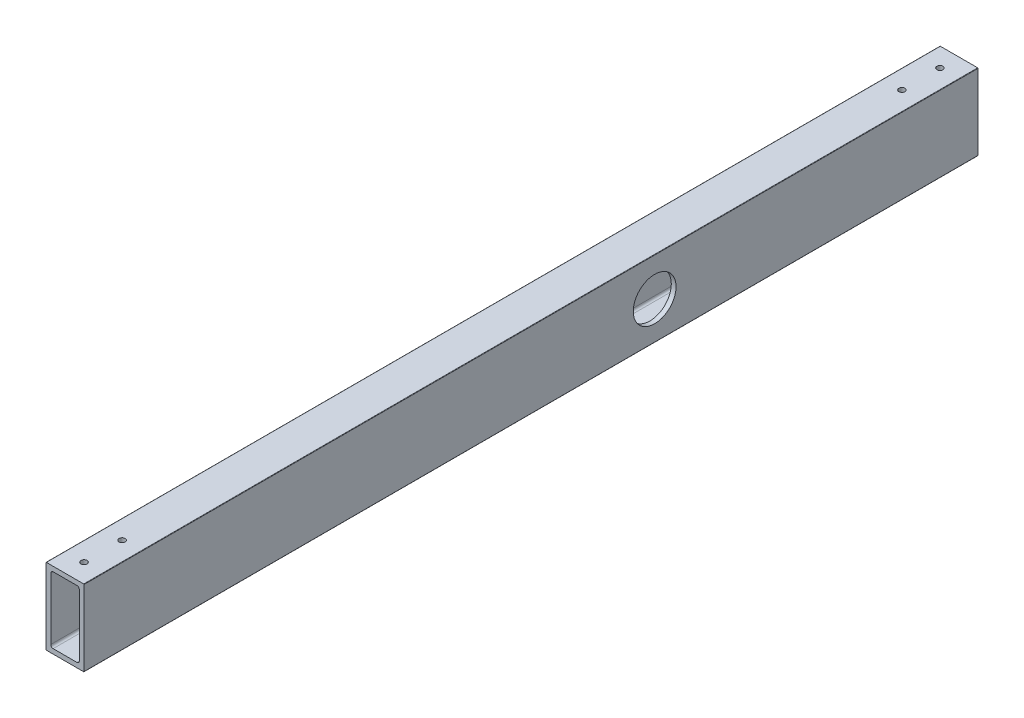
from build123d import *

# Parameters (mm, degrees)
BOSS_EXTRUDE1_DEPTH = 596.9
SKETCH2_R           = 2.032
CUT_EXTRUDE1_DEPTH  = 600.596039013
SKETCH5_R           = 14.2875
CUT_EXTRUDE2_DEPTH  = 600.596039013


with BuildPart() as part:
    # Sketch1 → Boss-Extrude1 (new body)
    with BuildSketch(Plane(origin=(0, 0, 0), x_dir=(-1, 0, 0), z_dir=(0, 0, -1))):
        with BuildLine():
            Line((0, 0.254), (0, 50.546))
            ThreePointArc((0, 50.546), (-0.074394878, 50.725605122), (-0.254, 50.8))
            Line((-0.254, 50.8), (-25.146, 50.8))
            ThreePointArc((-25.146, 50.8), (-25.325605122, 50.725605122), (-25.4, 50.546))
            Line((-25.4, 50.546), (-25.4, 0.254))
            ThreePointArc((-25.4, 0.254), (-25.325605122, 0.074394878), (-25.146, 0))
            Line((-25.146, 0), (-0.254, 0))
            ThreePointArc((-0.254, 0), (-0.074394878, 0.074394878), (0, 0.254))
        make_face()
        with BuildLine():
            Line((-3.175, 46.0375), (-3.175, 4.7625))
            ThreePointArc((-3.175, 4.7625), (-3.639967985, 3.639967985), (-4.7625, 3.175))
            Line((-4.7625, 3.175), (-20.6375, 3.175))
            ThreePointArc((-20.6375, 3.175), (-21.760032015, 3.639967985), (-22.225, 4.7625))
            Line((-22.225, 4.7625), (-22.225, 46.0375))
            ThreePointArc((-22.225, 46.0375), (-21.760032015, 47.160032015), (-20.6375, 47.625))
            Line((-20.6375, 47.625), (-4.7625, 47.625))
            ThreePointArc((-4.7625, 47.625), (-3.639967985, 47.160032015), (-3.175, 46.0375))
        make_face(mode=Mode.SUBTRACT)
    extrude(amount=-BOSS_EXTRUDE1_DEPTH)

    # Sketch2 → Cut-Extrude1 (cut, through all)
    with BuildSketch(Plane(origin=(0, 50.8, 0), x_dir=(1, 0, 0), z_dir=(0, 1, 0))):
        with Locations((12.7, -584.2)):
            Circle(SKETCH2_R)
        with Locations((12.7, -558.8)):
            Circle(SKETCH2_R)
        with Locations((12.7, -38.1)):
            Circle(SKETCH2_R)
        with Locations((12.7, -12.7)):
            Circle(SKETCH2_R)
    extrude(amount=-CUT_EXTRUDE1_DEPTH, mode=Mode.SUBTRACT)

    # Sketch5 → Cut-Extrude2 (cut, through all)
    with BuildSketch(Plane(origin=(25.4, 0, 0), x_dir=(0, 0, -1), z_dir=(1, 0, 0))):
        with Locations((-215.9, 25.146)):
            Circle(SKETCH5_R)
    extrude(amount=-CUT_EXTRUDE2_DEPTH, mode=Mode.SUBTRACT)


solid = part.part
